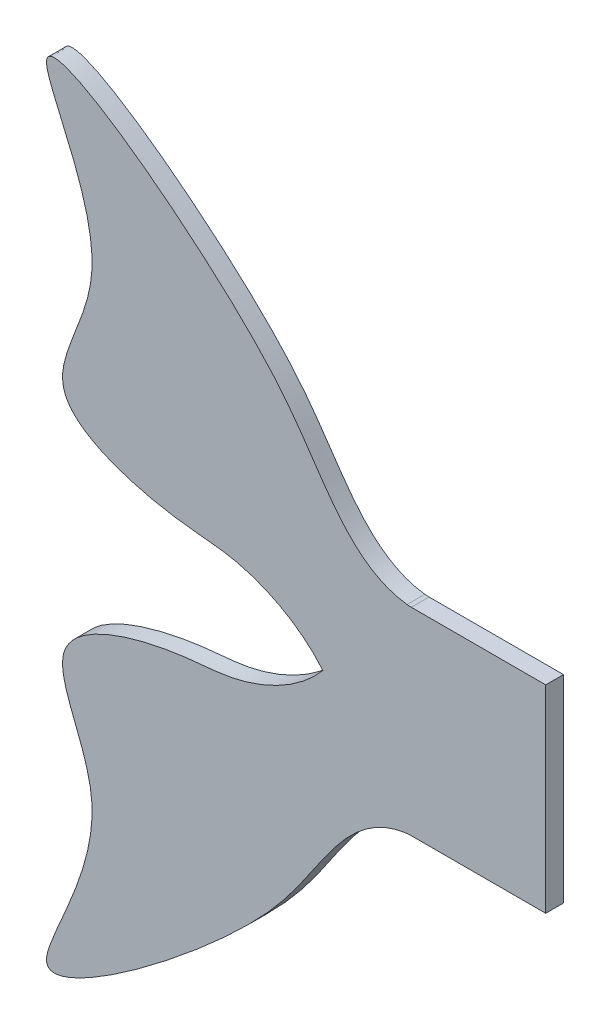
from build123d import *

# Parameters (mm, degrees)
BOSS_EXTRUDE1_DEPTH = 1.5
FILLET1_START       = -1.5
FILLET1_DEPTH       = 3


with BuildPart() as part:
    # Sketch1 → Boss-Extrude1 (new, symmetric)
    with BuildSketch(Plane(origin=(5.579709271, 0, 0), x_dir=(1, 0, 0), z_dir=(0, 0, 1))):
        with BuildLine():
            Line((35.418603529, 19.234414171), (58.418603529, 19.234414171))
            Line((58.418603529, 19.234414171), (58.418603529, -14.165585829))
            Line((58.418603529, -14.165585829), (35.418603529, -14.165585829))
            add(Edge.make_bspline(
                [(35.418603529, -14.165585829), (27.469289242, -14.892442329), (20.528186206, -25.641702148), (6.777728113, -45.141109278), (-40.80007994, -80.68801738), (-10.993005091, -37.936168927), (-30.654803397, -13.710810961), (-6.908202349, -7.14239348), (8.394802773, -6.473202881), (16.895886047, -2.145579432), (20.793572989, 2.534414171)],
                knots=[0, 0, 0, 0, 0.125076559, 0.192560443, 0.451722325, 0.613213328, 0.726080796, 0.854297924, 0.895646716, 1, 1, 1, 1], degree=3))
            add(Edge.make_bspline(
                [(35.418603529, 19.234414171), (27.469289242, 19.961270671), (20.528186206, 30.71053049), (6.777728113, 50.209937619), (-40.80007994, 85.756845722), (-10.993005091, 43.004997268), (-30.654803397, 18.779639303), (-6.908202349, 12.211221821), (8.394802773, 11.542031222), (16.895886047, 7.214407774), (20.793572989, 2.534414171)],
                knots=[0, 0, 0, 0, 0.125076559, 0.192560443, 0.451722325, 0.613213328, 0.726080796, 0.854297924, 0.895646716, 1, 1, 1, 1], degree=3))
        make_face()
    extrude(amount=BOSS_EXTRUDE1_DEPTH, both=True)

    # Fillet1: read off the stored shape, not the designer's step
    # Fillet1 outline → Fillet1 (add)
    with BuildSketch(Plane.XY.offset(FILLET1_START)):
        with BuildLine():
            add(Edge.make_bspline(
                [(40.595114738, -14.208132998), (40.728525801, -14.192160019), (40.862920239, -14.177965635), (40.9983128, -14.165585829)],
                knots=[0.997869699, 0.997869699, 0.997869699, 0.997869699, 1, 1, 1, 1], degree=3))
            ThreePointArc((40.595114738, -14.208132998), (40.951116393, -14.176232067), (41.308385907, -14.165585829))
            Line((41.308385907, -14.165585829), (40.9983128, -14.165585829))
        make_face()
        with BuildLine():
            Line((40.9983128, 19.234414171), (41.308385907, 19.234414171))
            ThreePointArc((41.308385907, 19.234414171), (40.951116393, 19.245060408), (40.595114738, 19.276961339))
            add(Edge.make_bspline(
                [(40.9983128, 19.234414171), (40.862920239, 19.246793976), (40.728525801, 19.260988361), (40.595114738, 19.276961339)],
                knots=[0, 0, 0, 0, 0.002130301, 0.002130301, 0.002130301, 0.002130301], degree=3))
        make_face()
    extrude(amount=FILLET1_DEPTH)


solid = part.part
